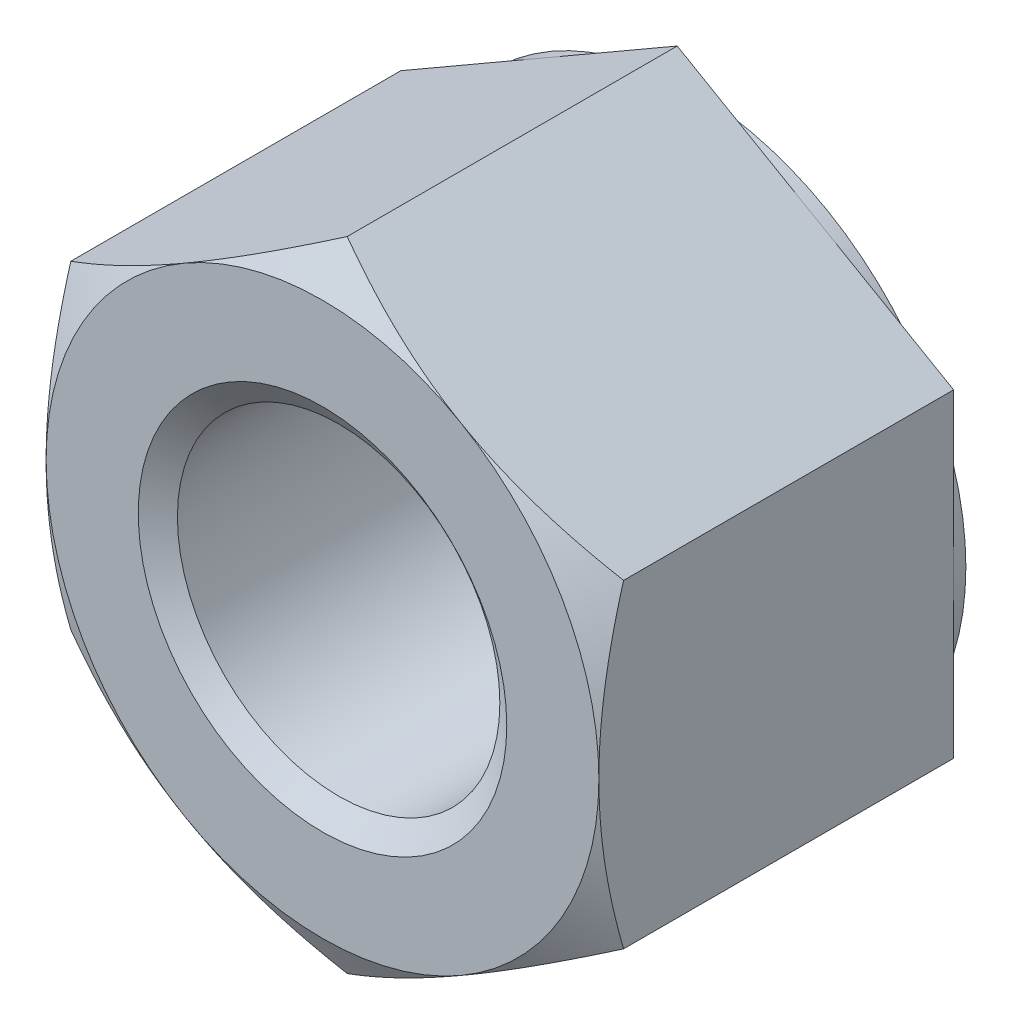
from build123d import *

# Parameters (mm, degrees)
BASENUTSKE_R  = 10.5
BASENUT_DEPTH = 23.9
SKETCH4_W     = 0.8
SKETCH4_H     = 12.784609691


with BuildPart() as part:
    # BaseNutSke → BaseNut (new body)
    with BuildSketch(Plane.XY):
        Polygon((18, 10.392304845), (18, -10.392304845), (0, -20.784609691), (-18, -10.392304845), (-18, 10.392304845), (0, 20.784609691), align=None)
        Circle(BASENUTSKE_R, mode=Mode.SUBTRACT)
    extrude(amount=-BASENUT_DEPTH)

    # Sketch4 → Bearing-Face (revolve, cut)
    with BuildSketch(Plane(origin=(0, 0, 0), x_dir=(0, 0, -1), z_dir=(1, 0, 0))):
        with Locations((23.5, 24.392304845)):
            Rectangle(SKETCH4_W, SKETCH4_H)
        Polygon((0, 18), (-10, 18), (-10, 30.784609691), (1.607695155, 30.784609691), (1.607695155, 20.784609691), align=None)
    revolve(axis=Axis((0, 0, 0), (0, 0, -1)), mode=Mode.SUBTRACT)

    # Sketch5 → EndChamfer (revolve, cut)
    with BuildSketch(Plane(origin=(0, 0, 0), x_dir=(0, 0, -1), z_dir=(1, 0, 0))):
        Polygon((23.9, 12), (22.849688693, 10.5), (23.9, 10.5), align=None)
        Polygon((0, 12), (1.050311307, 10.5), (0, 10.5), align=None)
    revolve(axis=Axis((0, 0, -25.037505729), (0, 0, -1)), mode=Mode.SUBTRACT)


solid = part.part
